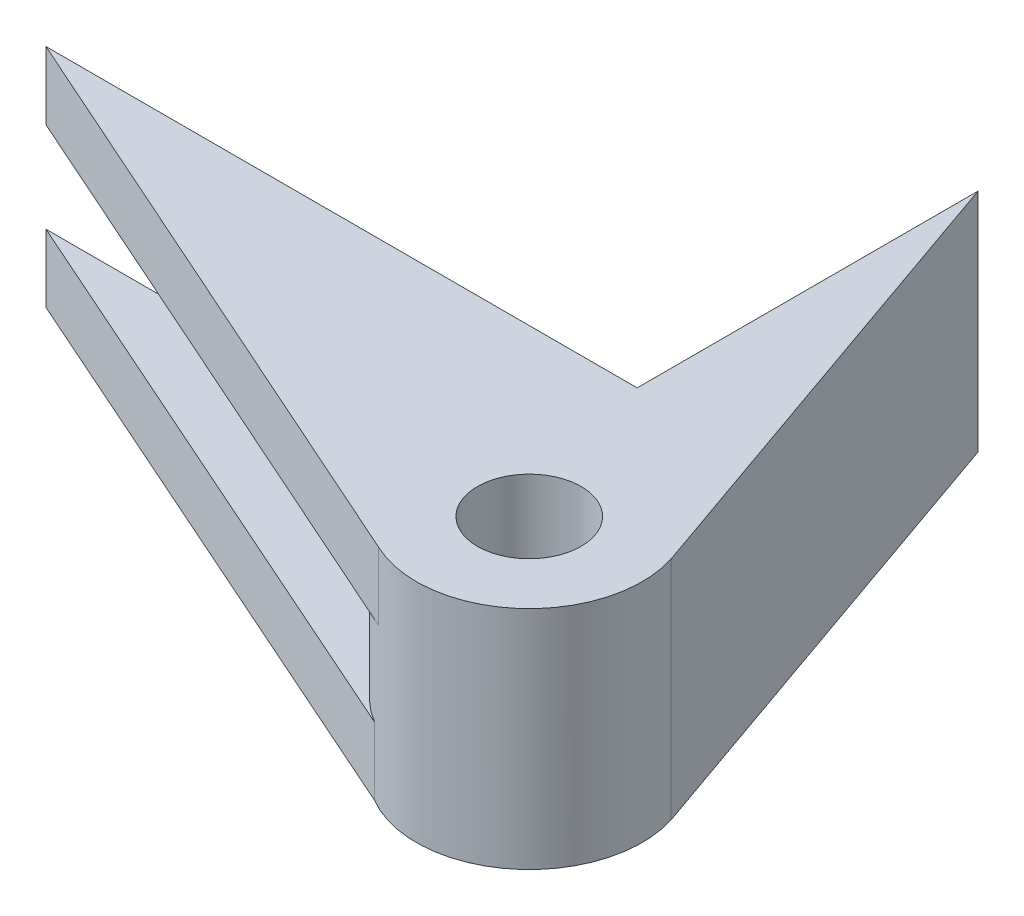
from build123d import *

# Parameters (mm, degrees)
SKETCH1_R           = 4.590078396
BOSS_EXTRUDE1_DEPTH = 6
SKETCH1_3_R         = 4.590078396
BOSS_EXTRUDE2_DEPTH = 20
BOSS_EXTRUDE3_START = -6
BOSS_EXTRUDE3_DEPTH = 6


with BuildPart() as part:
    # Sketch1 → Boss-Extrude1 (new body)
    with BuildSketch(Plane(origin=(0, 0, 0), x_dir=(1, 0, 0), z_dir=(0, 1, 0))):
        with BuildLine():
            Line((30.598786144, 30.167258341), (30.598786144, 0))
            Line((30.598786144, 0), (-21.72538797, 0))
            Line((-21.72538797, 0), (30.598786144, -23.243306965))
            ThreePointArc((30.598786144, -23.243306965), (41.902943868, -22.457813602), (45.216343262, -11.621653482))
            Line((45.216343262, -11.621653482), (30.598786144, 30.167258341))
        make_face()
        with Locations((35.679659415, -14.630251363)):
            Circle(SKETCH1_R, mode=Mode.SUBTRACT)
    extrude(amount=BOSS_EXTRUDE1_DEPTH)

    # Sketch1<3> → Boss-Extrude2 (add)
    with BuildSketch(Plane(origin=(0, 0, 0), x_dir=(1, 0, 0), z_dir=(0, 1, 0))):
        with BuildLine():
            Line((30.598786144, 30.167258341), (30.598786144, 0))
            Line((30.598786144, 0), (25.679659415, 0))
            Line((25.679659415, 0), (25.679659415, -14.630251363))
            ThreePointArc((25.679659415, -14.630251363), (37.201691204, -24.513743622), (45.216343262, -11.621653482))
            Line((45.216343262, -11.621653482), (30.598786144, 30.167258341))
        make_face()
        with Locations((35.679659415, -14.630251363)):
            Circle(SKETCH1_3_R, mode=Mode.SUBTRACT)
    extrude(amount=BOSS_EXTRUDE2_DEPTH)

    # Sketch2 → Boss-Extrude3 (add)
    with BuildSketch(Plane(origin=(0, 20, 0), x_dir=(1, 0, 0), z_dir=(0, 1, 0)).offset(BOSS_EXTRUDE3_START)):
        with BuildLine():
            ThreePointArc((25.679659415, -14.630251363), (33.853020624, -4.798497159), (45.01233756, -11.03843864))
            Line((45.01233756, -11.03843864), (30.598786144, 30.167258341))
            Line((30.598786144, 30.167258341), (30.598786144, 0))
            Line((30.598786144, 0), (-21.72538797, 0))
            Line((-21.72538797, 0), (31.366142543, -23.652089989))
            ThreePointArc((31.366142543, -23.652089989), (27.219896749, -19.962456876), (25.679659415, -14.630251363))
        make_face()
    extrude(amount=BOSS_EXTRUDE3_DEPTH)


solid = part.part
